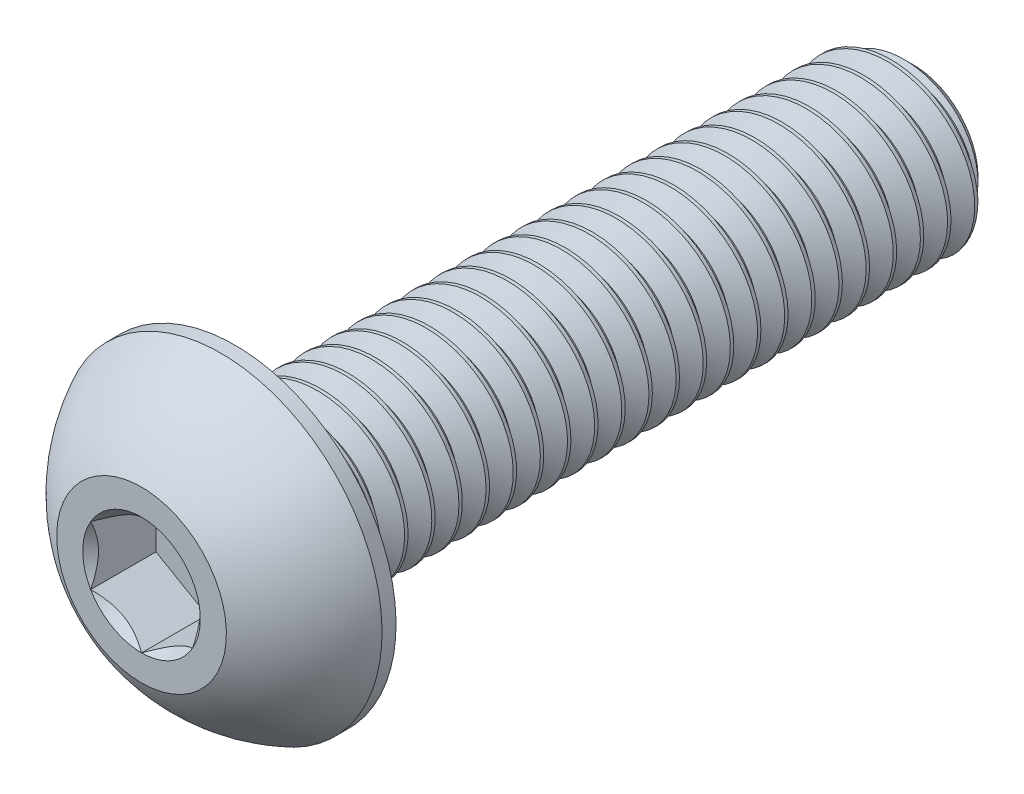
from build123d import *

# Parameters (mm, degrees)
CUT_EXTRUDE2_DEPTH = 1.925
CUT_SWEEP2_PITCH   = 0.8
CUT_SWEEP2_TO      = 20


with BuildPart() as part:
    # Sketch10 → Revolve3 (revolve)
    with BuildSketch(Plane(origin=(0, 0, 0), x_dir=(0, 0, -1), z_dir=(1, 0, 0)), mode=Mode.PRIVATE) as revolve3_sk:
        Polygon((9.4, 2.5), (10, 1.9), (10, 0), (-10, 0), (-10, 2.5), align=None)
    revolve(revolve3_sk.sketch.rotate(Axis((0, 0, 12.75), (0, 0, -1)), 180), axis=Axis((0, 0, 12.75), (0, 0, -1)))

    # Sketch7 → Revolve2 (revolve)
    with BuildSketch(Plane(origin=(0, 0, 0), x_dir=(0, 0, -1), z_dir=(1, 0, 0)), mode=Mode.PRIVATE) as revolve2_sk:
        with BuildLine():
            Line((-10.4125, 4.75), (-10, 4.75))
            Line((-10, 4.75), (-10, 0))
            Line((-10, 0), (-12.75, 0))
            Line((-12.75, 0), (-12.75, 2.5))
            ThreePointArc((-12.75, 2.5), (-11.758124817, 3.808753282), (-10.4125, 4.75))
        make_face()
    revolve(revolve2_sk.sketch.rotate(Axis((0, 0, 12.75), (0, 0, -1)), 180), axis=Axis((0, 0, 12.75), (0, 0, -1)))

    # Sketch5 → Cut-Extrude2 (cut)
    with BuildSketch(Plane.XY.offset(12.75)):
        Polygon((1.5, -0.866025404), (1.5, 0.866025404), (0, 1.732050808), (-1.5, 0.866025404), (-1.5, -0.866025404), (0, -1.732050808), align=None)
    extrude(amount=-CUT_EXTRUDE2_DEPTH, mode=Mode.SUBTRACT)

    # Cut-Extrude3 cone 1 section (through the dimple's axis) → Cut-Extrude3 (revolve, cut)
    with BuildSketch(Plane(origin=(0, 0, 12.75), x_dir=(0, -1, 0), z_dir=(1, 0, 0))):
        Polygon((0, 0), (1.732050808, 0), (0, 1.732050808), align=None)
    revolve(axis=Axis((0, 0, 12.75), (0, 0, -1)), mode=Mode.SUBTRACT)


with BuildPart() as body_2:
    # Split1: read off the stored shape, not the designer's step
    # Split1: the piece on the far side of the plane
    add(part.part)
    split(bisect_by=Plane.XY.offset(10), keep=Keep.BOTTOM)

    # Cut-Sweep2: arcs per turn and ends read off the stored shape
    # Cut-Sweep2: the profile of Sketch12 screwed along a right-hand helix through 30 turns, 8 arcs to a turn; built about Z, then put on its axis
    cut_sweep2_z = Axis((0, 0, 0), (0, 0, 1))
    cut_sweep2_corners = [(1.980384758, 0, -0.3), (1.980384758, 0, -0.4), (2.54330127, 0, -0.725), (2.54330127, 0, 0.025)]
    with BuildLine(mode=Mode.PRIVATE) as cut_sweep2_profile:
        Line(cut_sweep2_corners[0], cut_sweep2_corners[1])
        Line(cut_sweep2_corners[1], cut_sweep2_corners[2])
        Line(cut_sweep2_corners[2], cut_sweep2_corners[3])
        Line(cut_sweep2_corners[3], cut_sweep2_corners[0])
    cut_sweep2_cap = Face(cut_sweep2_profile.wire())
    cut_sweep2_turn_angles = [0, 22.5, 45, 67.5, 90, 112.5, 135, 157.5, 180, 202.5, 225, 247.5, 270, 292.5, 315, 337.5, 360]
    cut_sweep2_turn_weights = [1, 0.9238795325112867, 1, 0.9238795325112867, 1, 0.9238795325112867, 1, 0.9238795325112867, 1, 0.9238795325112867, 1, 0.9238795325112867, 1, 0.9238795325112867, 1, 0.9238795325112867, 1]
    cut_sweep2_turn_rails = [Edge.make_bspline([Vector(p[0], p[1], 0).rotate(cut_sweep2_z, cut_sweep2_turn_angles[k]) / cut_sweep2_turn_weights[k] + Vector(0, 0, p[2] + CUT_SWEEP2_PITCH * cut_sweep2_turn_angles[k] / 360) for k in range(17)], [0, 0, 0, 1, 1, 2, 2, 3, 3, 4, 4, 5, 5, 6, 6, 7, 7, 8, 8, 8], 2, cut_sweep2_turn_weights) for p in cut_sweep2_corners]
    cut_sweep2_turn_sides = [Face.make_surface_from_curves(cut_sweep2_turn_rails[p[0]], cut_sweep2_turn_rails[p[1]]) for p in [(0, 1), (1, 2), (2, 3), (3, 0)]]
    cut_sweep2 = Plane(origin=(0, 0, -10), x_dir=(0, 1, 0), z_dir=(0, 0, 1)) * split(Solid(Shell([*[p.moved(Location((0, 0, CUT_SWEEP2_PITCH * i))) for i in range(30) for p in cut_sweep2_turn_sides], cut_sweep2_cap, cut_sweep2_cap.rotate(cut_sweep2_z, 10800).moved(Location((0, 0, CUT_SWEEP2_PITCH * 10800 / 360)))])), bisect_by=Plane.XY.offset(CUT_SWEEP2_TO), keep=Keep.BOTTOM, mode=Mode.PRIVATE)
    add(cut_sweep2, mode=Mode.SUBTRACT)


with BuildPart() as part_1:
    add(part.part)

    # Split1
    split(bisect_by=Plane.XY.offset(10), keep=Keep.TOP)

    add(body_2.part)  # Boss-Extrude1 merges body 2
    # Boss-Extrude1: read off the stored shape, not the designer's step
    # Boss-Extrude1 outline → Boss-Extrude1 (revolve)
    with BuildSketch(Plane.XZ):
        Polygon((1.980384758, 10), (1.980384758, 9.480384758), (2.5, 10), align=None)
    revolve(axis=Axis((0, 0, 0), (0, 0, 1)))


solid = part_1.part
